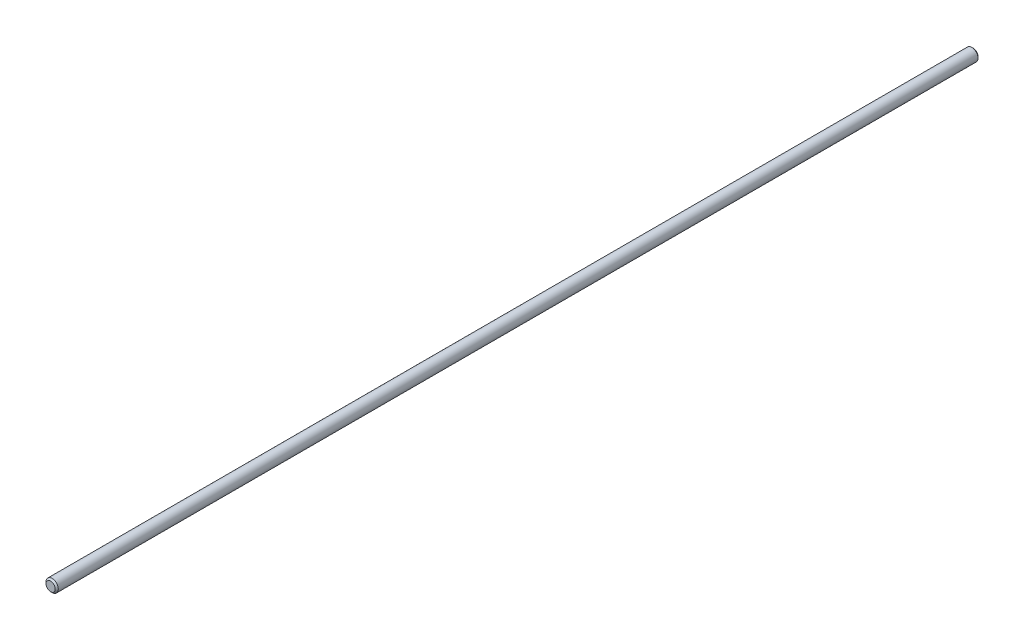
from build123d import *

# Parameters (mm, degrees)
SKETCH1_R           = 4
BOSS_EXTRUDE1_DEPTH = 601
CHAMFER1_SIZE       = 1


with BuildPart() as part:
    # Sketch1 → Boss-Extrude1 (new body)
    with BuildSketch(Plane.XY):
        Circle(SKETCH1_R)
    extrude(amount=BOSS_EXTRUDE1_DEPTH)

    # Chamfer1
    chamfer1_edges = [part.edges().sort_by_distance(p)[0] for p in [
        (-4, 0, 601),
        (-4, 0, 0),
    ]]
    chamfer(chamfer1_edges, length=CHAMFER1_SIZE)


solid = part.part
